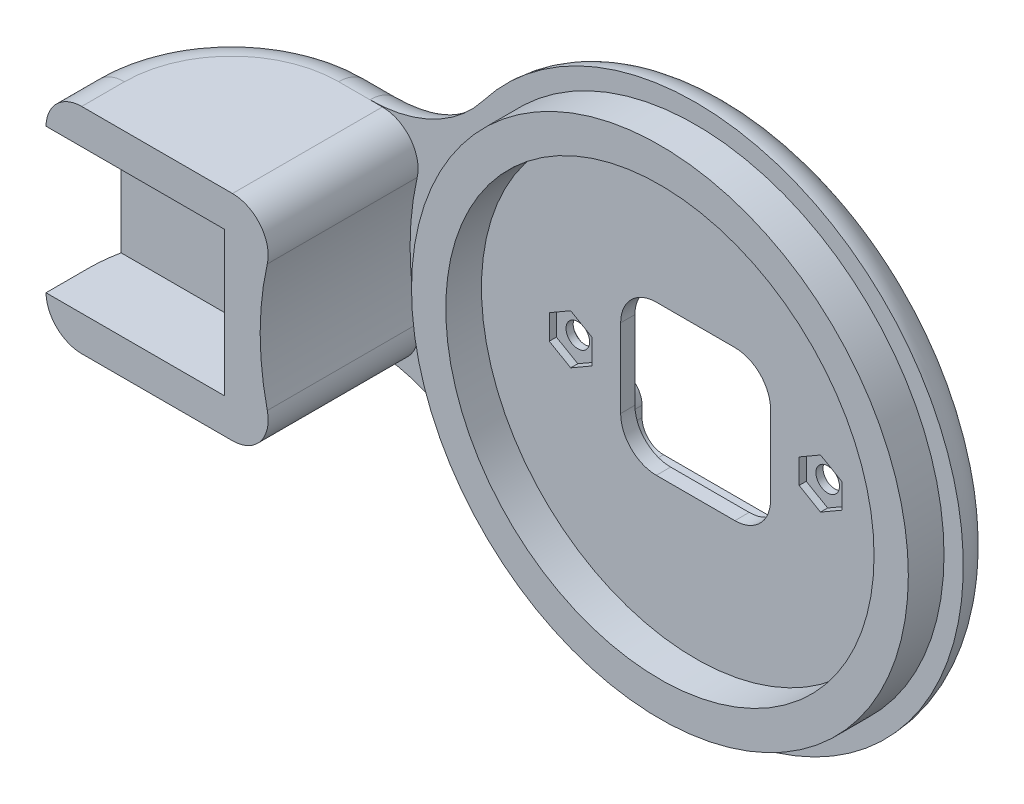
from build123d import *

# Parameters (mm, degrees)
BOSS_EXTRU_1_DEPTH      = 5
ESQUISSE6_R             = 34.8
ESQUISSE6_R_2           = 30
BOSS_EXTRU_6_DEPTH      = 5
BOSS_EXTRU_9_DEPTH      = 21
CONG_1_R                = 20
CONG_2_R                = 5
ESQUISSE11_W            = 20.2
ESQUISSE11_H            = 20.2
ENL_V_MAT_EXTRU_2_DEPTH = 25
ESQUISSE12_R            = 2.6
ENL_V_MAT_EXTRU_3_DEPTH = 81.987161213
ENL_V_START             = -5
ESQUISSE13_R            = 4.5
ENL_V_MAT_EXTRU_4_DEPTH = 76.987161213
ENL_V_MAT_EXTRU_5_DEPTH = 2
ENL_V_MAT_EXTRU_7_DEPTH = 3
ESQUISSE19_R            = 1.65
ENL_V_MAT_EXTRU_8_DEPTH = 83.674725752
ENL_V_MAT_EXTRU_9_DEPTH = 1


with BuildPart() as part:
    # Esquisse1 → Boss.-Extru.1 (new body)
    with BuildSketch(Plane.XY):
        with BuildLine():
            Line((-45.620718977, 15), (-70, 15))
            Line((-70, 15), (-70, -15))
            Line((-70, -15), (-45.620718977, -15))
            ThreePointArc((-45.620718977, -15), (-36.774201608, -17.062911874), (-29.752642811, -22.826086957))
            ThreePointArc((-29.752642811, -22.826086957), (37.5, 0), (-29.752642811, 22.826086957))
            ThreePointArc((-29.752642811, 22.826086957), (-36.774201608, 17.062911874), (-45.620718977, 15))
        make_face()
    extrude(amount=BOSS_EXTRU_1_DEPTH)

    # Esquisse6 → Boss.-Extru.6 (add)
    with BuildSketch(Plane.XY.offset(5)):
        Circle(ESQUISSE6_R)
        Circle(ESQUISSE6_R_2, mode=Mode.SUBTRACT)
    extrude(amount=BOSS_EXTRU_6_DEPTH)

    # Esquisse8 → Boss.-Extru.9 (add)
    with BuildSketch(Plane.XY.offset(5)):
        with BuildLine():
            Line((-70, -15), (-70, 15))
            Line((-70, 15), (-43.874821937, 15))
            ThreePointArc((-43.874821937, 15), (-39.966142137, 13.118047822), (-38.999841722, 8.888888889))
            ThreePointArc((-38.999841722, 8.888888889), (-40, 0), (-38.999841722, -8.888888889))
            ThreePointArc((-38.999841722, -8.888888889), (-39.966142137, -13.118047822), (-43.874821937, -15))
            Line((-43.874821937, -15), (-70, -15))
        make_face()
    extrude(amount=BOSS_EXTRU_9_DEPTH)

    # Congé1
    cong_1_edges = [part.edges().sort_by_distance(p)[0] for p in [
        (-70, 0, 0),
    ]]
    fillet(cong_1_edges, radius=CONG_1_R)

    # Congé2
    cong_2_edges = [part.edges().sort_by_distance(p)[0] for p in [
        (-47.810359489, -15, 0),
        (-36.774201608, -17.062911874, 0),
        (37.5, 0, 0),
        (-36.774201608, 17.062911874, 0),
        (-47.810359489, 15, 0),
        (-64.142135624, 15, 5.857864376),
        (-64.142135624, -15, 5.857864376),
        (-70, -15, 23),
        (-70, 15, 23),
    ]]
    fillet(cong_2_edges, radius=CONG_2_R - 0.0001)  # a hair under: the kernel refuses the full size

    # Esquisse11 → Enlèv. mat.-Extru.2 (cut)
    with BuildSketch(Plane.ZY.offset(70)):
        with Locations((26, 0)):
            Rectangle(ESQUISSE11_W, ESQUISSE11_H)
    extrude(amount=-ENL_V_MAT_EXTRU_2_DEPTH, mode=Mode.SUBTRACT)

    # Esquisse12 → Enlèv. mat.-Extru.3 (cut, through all)
    with BuildSketch(Plane.XY.offset(15.9)):
        with Locations((-49.575239462, 0)):
            Circle(ESQUISSE12_R)
    extrude(amount=-ENL_V_MAT_EXTRU_3_DEPTH, mode=Mode.SUBTRACT)

    # Esquisse13 → Enlèv. mat.-Extru.4 (cut, through all)
    with BuildSketch(Plane.XY.offset(15.9).offset(ENL_V_START)):
        with Locations((-49.575239462, 0)):
            Circle(ESQUISSE13_R)
    extrude(amount=-ENL_V_MAT_EXTRU_4_DEPTH, mode=Mode.SUBTRACT)

    # Esquisse14 → Enlèv. mat.-Extru.5 (cut)
    with BuildSketch(Plane.XY.offset(5)):
        with BuildLine():
            Line((-5.5, 10.5), (5.5, 10.5))
            ThreePointArc((5.5, 10.5), (9.035533906, 9.035533906), (10.5, 5.5))
            Line((10.5, 5.5), (10.5, -5.5))
            ThreePointArc((10.5, -5.5), (9.035533906, -9.035533906), (5.5, -10.5))
            Line((5.5, -10.5), (-5.5, -10.5))
            ThreePointArc((-5.5, -10.5), (-9.035533906, -9.035533906), (-10.5, -5.5))
            Line((-10.5, -5.5), (-10.5, 5.5))
            ThreePointArc((-10.5, 5.5), (-9.035533906, 9.035533906), (-5.5, 10.5))
        make_face()
    extrude(amount=-ENL_V_MAT_EXTRU_5_DEPTH, mode=Mode.SUBTRACT)

    # Esquisse17 → Enlèv. mat.-Extru.7 (cut)
    with BuildSketch(Plane(origin=(0, 0, 0), x_dir=(-1, 0, 0), z_dir=(0, 0, -1))):
        with BuildLine():
            Line((15.5, 5), (19.5, 5))
            ThreePointArc((19.5, 5), (21.621320344, 4.121320344), (22.5, 2))
            Line((22.5, 2), (22.5, -2))
            ThreePointArc((22.5, -2), (21.621320344, -4.121320344), (19.5, -5))
            Line((19.5, -5), (15.5, -5))
            ThreePointArc((15.5, -5), (13.378679656, -5.878679656), (12.5, -8))
            Line((12.5, -8), (12.5, -9.5))
            ThreePointArc((12.5, -9.5), (11.621320344, -11.621320344), (9.5, -12.5))
            Line((9.5, -12.5), (-9.5, -12.5))
            ThreePointArc((-9.5, -12.5), (-11.621320344, -11.621320344), (-12.5, -9.5))
            Line((-12.5, -9.5), (-12.5, -8))
            ThreePointArc((-12.5, -8), (-13.378679656, -5.878679656), (-15.5, -5))
            Line((-15.5, -5), (-19.5, -5))
            ThreePointArc((-19.5, -5), (-21.621320344, -4.121320344), (-22.5, -2))
            Line((-22.5, -2), (-22.5, 2))
            ThreePointArc((-22.5, 2), (-21.621320344, 4.121320344), (-19.5, 5))
            Line((-19.5, 5), (-15.5, 5))
            ThreePointArc((-15.5, 5), (-13.378679656, 5.878679656), (-12.5, 8))
            Line((-12.5, 8), (-12.5, 9.5))
            ThreePointArc((-12.5, 9.5), (-11.621320344, 11.621320344), (-9.5, 12.5))
            Line((-9.5, 12.5), (9.5, 12.5))
            ThreePointArc((9.5, 12.5), (11.621320344, 11.621320344), (12.5, 9.5))
            Line((12.5, 9.5), (12.5, 8))
            ThreePointArc((12.5, 8), (13.378679656, 5.878679656), (15.5, 5))
        make_face()
    extrude(amount=-ENL_V_MAT_EXTRU_7_DEPTH, mode=Mode.SUBTRACT)

    # Esquisse19 → Enlèv. mat.-Extru.8 (cut, through all)
    with BuildSketch(Plane(origin=(0, 0, 3), x_dir=(-1, 0, 0), z_dir=(0, 0, -1))):
        with Locations((17.5, 0)):
            Circle(ESQUISSE19_R)
        with Locations(Location((-17.5, 0, 0), (0, 0, 180))):
            Circle(ESQUISSE19_R)
    extrude(amount=-ENL_V_MAT_EXTRU_8_DEPTH, mode=Mode.SUBTRACT)

    # Esquisse20 → Enlèv. mat.-Extru.9 (cut)
    with BuildSketch(Plane.XY.offset(5)):
        Polygon((-17.5, -3.464101615), (-14.5, -1.732050808), (-14.5, 1.732050808), (-17.5, 3.464101615), (-20.5, 1.732050808), (-20.5, -1.732050808), align=None)
        Polygon((20.5, -1.732050808), (17.5, -3.464101615), (14.5, -1.732050808), (14.5, 1.732050808), (17.5, 3.464101615), (20.5, 1.732050808), align=None)
    extrude(amount=-ENL_V_MAT_EXTRU_9_DEPTH, mode=Mode.SUBTRACT)


solid = part.part
